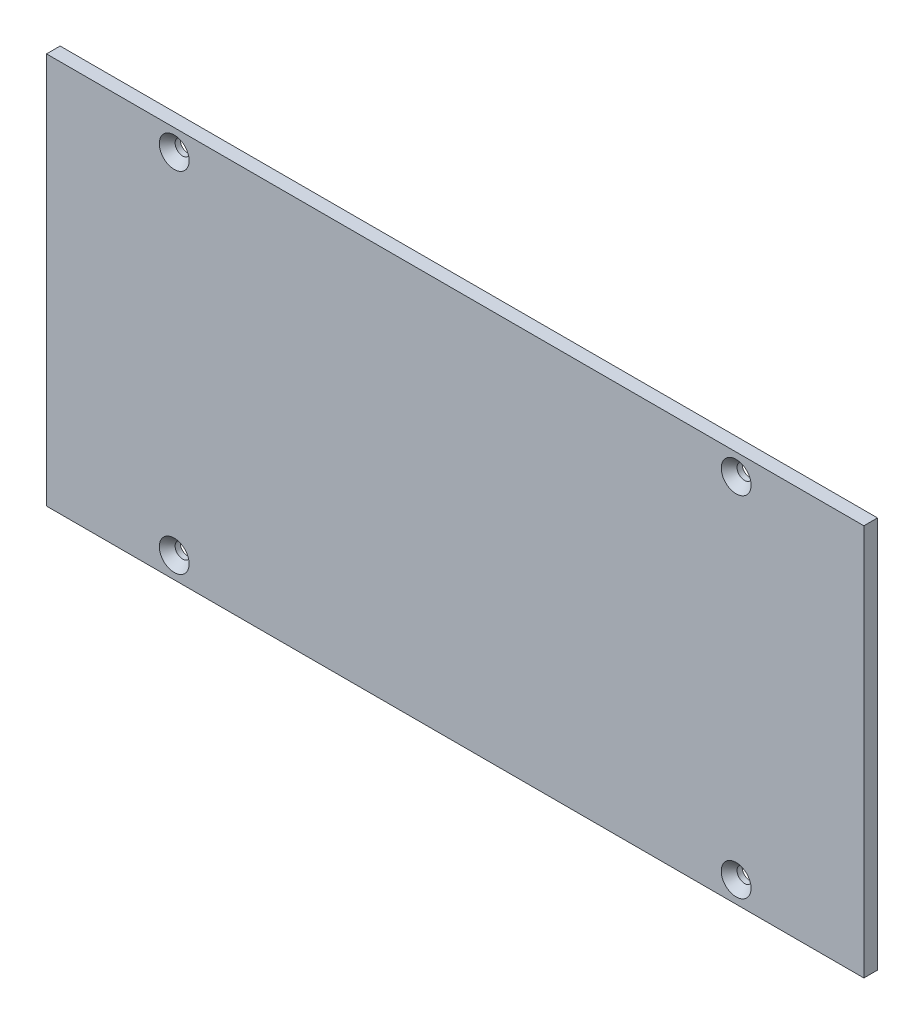
from build123d import *

# Parameters (mm, degrees)
SKETCH1_W                                     = 96
SKETCH1_H                                     = 46
BOSS_EXTRUDE1_DEPTH                           = 1.6002
CSK_FOR_0_FLAT_HEAD_SOCKET_CAP_SCREW1_A_COUNT = 2
CSK_FOR_0_FLAT_HEAD_SOCKET_CAP_SCREW1_A_PITCH = 41
CSK_FOR_0_FLAT_HEAD_SOCKET_CAP_SCRE_2_COUNT   = 2
CSK_FOR_0_FLAT_HEAD_SOCKET_CAP_SCRE_2_PITCH   = 77.698133826
CSK_FOR_0_FLAT_HEAD_SOCKET_CAP_SCRE_3_COUNT   = 2
CSK_FOR_0_FLAT_HEAD_SOCKET_CAP_SCRE_3_PITCH   = 66


with BuildPart() as part:
    # Sketch1 → Boss-Extrude1 (new body)
    with BuildSketch(Plane.XY):
        with Locations((48, 23)):
            Rectangle(SKETCH1_W, SKETCH1_H)
    extrude(amount=BOSS_EXTRUDE1_DEPTH)

    # Sketch7 → CSK for #0 Flat Head Socket Cap Screw1 (revolve, cut)
    with BuildSketch(Plane(origin=(15, 43.5, 1.6002), x_dir=(0, -1, 0), z_dir=(1, 0, 0))):
        Polygon((0, 0), (0, 1.6002), (0.889, 1.6002), (0.889, 0.993458156), (1.7526, 0), align=None)
    csk_for_0_flat_head_socket_cap_screw1 = revolve(axis=Axis((15, 43.5, 7.9502), (0, 0, -1)), mode=Mode.SUBTRACT)

    # CSK for #0 Flat Head Socket Cap Screw1 a: CSK for #0 Flat Head Socket Cap Screw1 ×2
    with Locations(*[(0, -i * CSK_FOR_0_FLAT_HEAD_SOCKET_CAP_SCREW1_A_PITCH, 0) for i in range(1, CSK_FOR_0_FLAT_HEAD_SOCKET_CAP_SCREW1_A_COUNT)]):
        add(csk_for_0_flat_head_socket_cap_screw1, mode=Mode.SUBTRACT)

    # CSK for _0 Flat Head Socket Cap Scre 2: CSK for #0 Flat Head Socket Cap Screw1 ×2
    with Locations(*[Vector(0.8494412510349073, -0.5276832014004724, 0) * (i * CSK_FOR_0_FLAT_HEAD_SOCKET_CAP_SCRE_2_PITCH) for i in range(1, CSK_FOR_0_FLAT_HEAD_SOCKET_CAP_SCRE_2_COUNT)]):
        add(csk_for_0_flat_head_socket_cap_screw1, mode=Mode.SUBTRACT)

    # CSK for _0 Flat Head Socket Cap Scre 3: CSK for #0 Flat Head Socket Cap Screw1 ×2
    with Locations(*[(i * CSK_FOR_0_FLAT_HEAD_SOCKET_CAP_SCRE_3_PITCH, 0, 0) for i in range(1, CSK_FOR_0_FLAT_HEAD_SOCKET_CAP_SCRE_3_COUNT)]):
        add(csk_for_0_flat_head_socket_cap_screw1, mode=Mode.SUBTRACT)


solid = part.part
